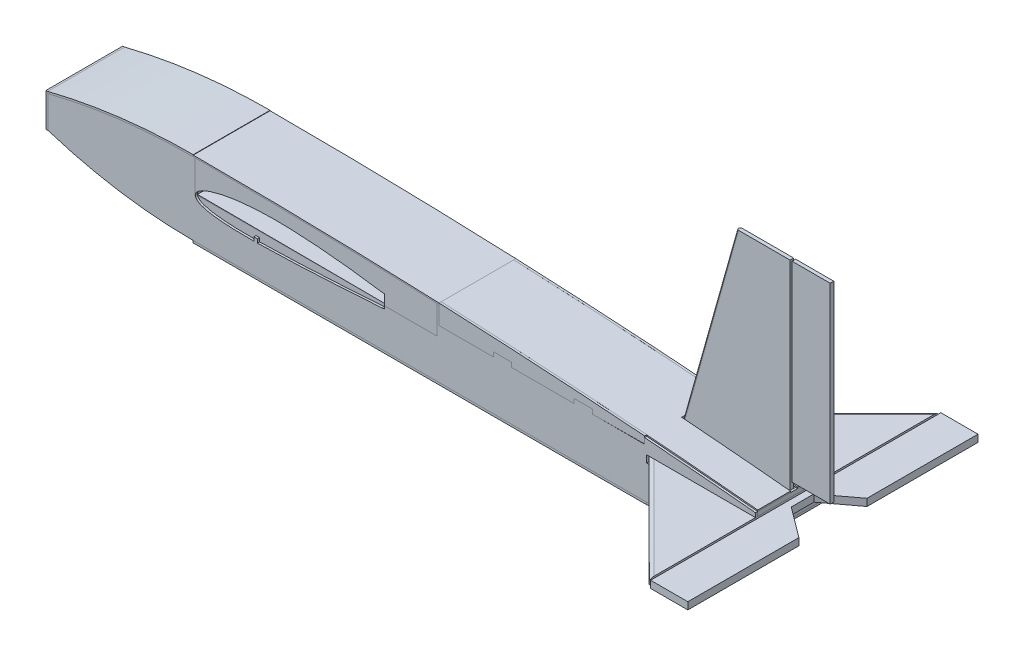
from build123d import *

# Parameters (mm, degrees)
BOSS_EXTRUDE4_DEPTH              = 3
BOSS_EXTRUDE5_DEPTH              = 3
SKETCH12_W                       = 101.6
SKETCH12_H                       = 98.6
BOSS_EXTRUDE6_DEPTH              = 2.8
SKETCH13_W                       = 101.6
SKETCH13_H                       = 94.334624953
BOSS_EXTRUDE7_DEPTH              = 2.8
SKETCH14_W                       = 101.6
SKETCH14_H                       = 76.899975786
BOSS_EXTRUDE8_DEPTH              = 2.8
SKETCH15_W                       = 101.6
SKETCH15_H                       = 31.75
BOSS_EXTRUDE9_DEPTH              = 2.8
SKETCH16_W                       = 101.6
SKETCH16_H                       = 66.907612553
BOSS_EXTRUDE10_DEPTH             = 8.399999964
BOSS_EXTRUDE10_DRAFT             = -7
CUT_EXTRUDE1_DEPTH               = 995.093803285
CUT_EXTRUDE1_DEPTH_BACK          = 995.093803285
SKETCH18_W                       = 152.4
SKETCH18_H                       = 10
SKETCH19_W                       = 149.6
SKETCH19_H                       = 11.952
BOSS_EXTRUDE12_DEPTH             = 10
BOSS_EXTRUDE12_2_DEPTH           = 10
BOSS_EXTRUDE13_DEPTH             = 10
SKETCH21_W                       = 139.7
SKETCH21_H                       = 12.7
BOSS_EXTRUDE14_DEPTH             = 10
BOSS_EXTRUDE14_2_DEPTH           = 10
CHAMFER1_SIZE                    = 76.2
CHAMFER1_SIZE2                   = 8.008942727
CHAMFER2_SIZE                    = 76.2
CHAMFER2_SIZE2                   = 8.008942727
CUT_EXTRUDE2_DEPTH               = 1014.488857078
CUT_EXTRUDE2_DEPTH_BACK          = 1014.488857078
SKETCH22_R                       = 1.27
SKETCH23_W                       = 406.4
SKETCH23_H                       = 10
BOSS_EXTRUDE15_DEPTH             = 52.07
CUT_EXTRUDE3_DEPTH               = 1067.340272357
CUT_EXTRUDE3_DEPTH_BACK          = 1067.340272357
SKETCH25_W                       = 127
SKETCH25_H                       = 5
BOSS_EXTRUDE16_REACH             = 1068.674
BOSS_EXTRUDE16_DIRECTION_2_REACH = 1068.674
BOSS_EXTRUDE17_REACH             = 1102.826
SKETCH27_W                       = 53.34
SKETCH27_H                       = 267.97
BOSS_EXTRUDE17_DIRECTION_2_REACH = 1102.826
CUT_EXTRUDE4_DEPTH               = 1101.826300603
CUT_EXTRUDE4_DEPTH_BACK          = 1101.826300603
BOSS_EXTRUDE19_DEPTH             = 3
CUT_EXTRUDE5_DEPTH               = 1103.33207779
EXTRUDE_THIN2_START              = -53.8
EXTRUDE_THIN2_DEPTH              = 107.6
EXTRUDE_THIN4_START              = -50.8
EXTRUDE_THIN4_DEPTH              = 101.6
CUT_EXTRUDE_THIN2_DEPTH          = 5
CUT_EXTRUDE_THIN2_DEPTH_BACK     = 5
CUT_EXTRUDE6_START               = -53.8
CUT_EXTRUDE6_DEPTH               = 107.6
BOSS_EXTRUDE21_DEPTH             = 3
EXTRUDE_THIN5_START              = -53.8
EXTRUDE_THIN5_DEPTH              = 107.6
CUT_EXTRUDE7_DEPTH               = 646.433676735
CUT_EXTRUDE7_DEPTH_BACK          = 646.433676735
SKETCH46_W                       = 101.6
SKETCH46_H                       = 3.058553549
SKETCH47_W                       = 107.6
SKETCH47_H                       = 3
BOSS_EXTRUDE22_DEPTH             = 155.672163536
SKETCH48_W                       = 101.6
SKETCH48_H                       = 3
SWEEP6_START                     = 203.2
SWEEP6_OUTLINE_W                 = 3
SWEEP6_OUTLINE_H                 = 107.6
SWEEP6_DEPTH                     = 635
SKETCH49_W                       = 107.6
SKETCH49_H                       = 47.213653824
BOSS_EXTRUDE23_DEPTH             = 3
FILLET1_R                        = 5.08
FILLET2_R                        = 2.54
EXTRUDE_THIN6_START              = -50.8
EXTRUDE_THIN6_DEPTH              = 101.6
SKETCH51_W                       = 338.57
SKETCH51_H                       = 51.722808022
BOSS_EXTRUDE24_DEPTH             = 10


# Read off the part's stored shape, not the designer's step: Extrude-Thin2, Extrude-Thin4, Cut-Extrude6, Extrude-Thin5, Sweep6, Extrude-Thin6
with BuildPart() as part:
    # Sketch7 → Boss-Extrude4 (new body)
    with BuildSketch(Plane.XY.offset(50.8)):
        with BuildLine():
            ThreePointArc((203.2, 38.1), (100.827823604, 31.801244765), (0, 13))
            Line((0, 13), (0, -31.75))
            ThreePointArc((0, -31.75), (100.367244397, -55.514635862), (203.2, -63.5))
            Line((203.2, -63.5), (838.2, -63.5))
            Line((838.2, -63.5), (990.6, -31.75))
            Line((990.6, -31.75), (990.6, 0))
            ThreePointArc((990.6, 0), (597.360617642, 28.56943127), (203.2, 38.1))
        make_face()
    extrude(amount=BOSS_EXTRUDE4_DEPTH)


with BuildPart() as body_2:
    # Sketch8 → Boss-Extrude5 (new body)
    with BuildSketch(Plane.XY.offset(-50.8)):
        with BuildLine():
            Line((990.6, -31.75), (990.6, 0))
            ThreePointArc((990.6, 0), (597.360617642, 28.56943127), (203.2, 38.1))
            ThreePointArc((203.2, 38.1), (100.827823604, 31.801244765), (0, 13))
            Line((0, 13), (0, -31.75))
            ThreePointArc((0, -31.75), (100.367244397, -55.514635862), (203.2, -63.5))
            Line((203.2, -63.5), (838.2, -63.5))
            Line((838.2, -63.5), (990.6, -31.75))
        make_face()
    extrude(amount=-BOSS_EXTRUDE5_DEPTH)


with BuildPart() as body_3:
    # Sketch12 → Boss-Extrude6 (new body)
    with BuildSketch(Plane(origin=(203.2, 0, 0), x_dir=(0, 0, -1), z_dir=(1, 0, 0))):
        with Locations((0, -11.2)):
            Rectangle(SKETCH12_W, SKETCH12_H)
    extrude(amount=BOSS_EXTRUDE6_DEPTH)


with BuildPart() as body_4:
    # Sketch13 → Boss-Extrude7 (new body)
    with BuildSketch(Plane(origin=(547.37, 0, 0), x_dir=(0, 0, -1), z_dir=(1, 0, 0))):
        with Locations((0, -16.332687524)):
            Rectangle(SKETCH13_W, SKETCH13_H)
    extrude(amount=-BOSS_EXTRUDE7_DEPTH)


with BuildPart() as body_5:
    # Sketch14 → Boss-Extrude8 (new body)
    with BuildSketch(Plane(origin=(838.2, 0, 0), x_dir=(0, 0, -1), z_dir=(1, 0, 0))):
        with Locations((0, -25.108565656)):
            Rectangle(SKETCH14_W, SKETCH14_H)
    extrude(amount=-BOSS_EXTRUDE8_DEPTH)


with BuildPart() as body_6:
    # Sketch15 → Boss-Extrude9 (new body)
    with BuildSketch(Plane(origin=(990.6, 0, 0), x_dir=(0, 0, -1), z_dir=(1, 0, 0))):
        with Locations((0, -15.875)):
            Rectangle(SKETCH15_W, SKETCH15_H)
    extrude(amount=-BOSS_EXTRUDE9_DEPTH)


with BuildPart() as body_7:
    # Sketch16 → Boss-Extrude10 (with draft: the straight prism first)
    with BuildSketch(Plane(origin=(50.8, 0, 0), x_dir=(0, 0, -1), z_dir=(1, 0, 0))):
        with Locations((0, -9.37813313)):
            Rectangle(SKETCH16_W, SKETCH16_H)
    extrude(amount=BOSS_EXTRUDE10_DEPTH)
    # Boss-Extrude10: the draft: its side faces are tilted about the plane it starts from
    boss_extrude10_sides = [body_7.faces().sort_by_distance(p)[0] for p in [
        (54.999999982, -9.37813313, 50.8),
        (54.999999982, -42.831939406, 0),
        (54.999999982, -9.37813313, -50.8),
        (54.999999982, 24.075673147, 0),
    ]]
    draft(boss_extrude10_sides, Plane(origin=(50.8, 0, 0), x_dir=(0, 0, -1), z_dir=(1, 0, 0)), BOSS_EXTRUDE10_DRAFT)


with BuildPart() as cut_extrude1_tool:
    # Sketch18 → Cut-Extrude1 (new, two sides: drawn at the far end of the back side and taken through both)
    with BuildSketch(Plane.XY.offset(-CUT_EXTRUDE1_DEPTH_BACK)):
        with Locations((914.4, -10.875)):
            Rectangle(SKETCH18_W, SKETCH18_H)
    extrude(amount=CUT_EXTRUDE1_DEPTH + CUT_EXTRUDE1_DEPTH_BACK)


with BuildPart() as part_1:
    add(part.part)

    # Cut-Extrude1: cut by cut_extrude1_tool
    add(cut_extrude1_tool.part, mode=Mode.SUBTRACT)


with BuildPart() as body_2_1:
    add(body_2.part)

    # Cut-Extrude1: cut by cut_extrude1_tool
    add(cut_extrude1_tool.part, mode=Mode.SUBTRACT)


with BuildPart() as body_6_1:
    add(body_6.part)

    # Cut-Extrude1: cut by cut_extrude1_tool
    add(cut_extrude1_tool.part, mode=Mode.SUBTRACT)


with BuildPart() as body_8:
    # Sketch19 → Boss-Extrude12 (new body)
    with BuildSketch(Plane(origin=(0, -15.875, 0), x_dir=(1, 0, 0), z_dir=(0, 1, 0))):
        with Locations((913, -44.824)):
            Rectangle(SKETCH19_W, SKETCH19_H)
    extrude(amount=-BOSS_EXTRUDE12_DEPTH)


with BuildPart() as body_9:
    # Sketch19 → Boss-Extrude12 2 (new body)
    with BuildSketch(Plane(origin=(0, -15.875, 0), x_dir=(1, 0, 0), z_dir=(0, 1, 0))):
        with Locations((913, 44.824)):
            Rectangle(SKETCH19_W, SKETCH19_H)
    extrude(amount=-BOSS_EXTRUDE12_2_DEPTH)


with BuildPart() as body_10:
    # Sketch20 → Boss-Extrude13 (new body)
    with BuildSketch(Plane(origin=(0, -15.875, 0), x_dir=(1, 0, 0), z_dir=(0, 1, 0))):
        Polygon((838.2, 50.8), (838.2, -50.8), (990.6, -203.2), (990.6, 203.2), align=None)
    extrude(amount=BOSS_EXTRUDE13_DEPTH)


with BuildPart() as body_11:
    # Sketch21 → Boss-Extrude14 (new body)
    with BuildSketch(Plane(origin=(0, -5.875, 0), x_dir=(1, 0, 0), z_dir=(0, 1, 0))):
        with Locations((908.05, 44.45)):
            Rectangle(SKETCH21_W, SKETCH21_H)
    extrude(amount=BOSS_EXTRUDE14_DEPTH)

    # Chamfer1
    chamfer1_edges = [body_11.edges().sort_by_distance(p)[0] for p in [
        (977.9, 4.125, -44.45),
    ]]
    chamfer1_side = [body_11.faces().sort_by_distance(p)[0] for p in [
        (908.05, 4.125, -44.45),
    ]]
    chamfer(chamfer1_edges, length=CHAMFER1_SIZE, length2=CHAMFER1_SIZE2, reference=chamfer1_side[0])


with BuildPart() as body_12:
    # Sketch21 → Boss-Extrude14 2 (new body)
    with BuildSketch(Plane(origin=(0, -5.875, 0), x_dir=(1, 0, 0), z_dir=(0, 1, 0))):
        with Locations((908.05, -44.45)):
            Rectangle(SKETCH21_W, SKETCH21_H)
    extrude(amount=BOSS_EXTRUDE14_2_DEPTH)

    # Chamfer2
    chamfer2_edges = [body_12.edges().sort_by_distance(p)[0] for p in [
        (977.9, 4.125, 44.45),
    ]]
    chamfer2_side = [body_12.faces().sort_by_distance(p)[0] for p in [
        (908.05, 4.125, 44.45),
    ]]
    chamfer(chamfer2_edges, length=CHAMFER2_SIZE, length2=CHAMFER2_SIZE2, reference=chamfer2_side[0])


with BuildPart() as cut_extrude2_tool:
    # Sketch22 → Cut-Extrude2 (new, two sides: drawn at the far end of the back side and taken through both)
    with BuildSketch(Plane(origin=(0, 4.125, 0), x_dir=(1, 0, 0), z_dir=(0, 1, 0)).offset(-CUT_EXTRUDE2_DEPTH_BACK)):
        with Locations(Location((872.077439947, 45.6, 0), (0, 0, 270))):
            Circle(SKETCH22_R)
        with Locations(Location((935.482, 45.6, 0), (0, 0, 270))):
            Circle(SKETCH22_R)
        with Locations(Location((935.482, -45.6, 0), (0, 0, 180))):
            Circle(SKETCH22_R)
        with Locations(Location((872.077439947, -45.6, 0), (0, 0, 90))):
            Circle(SKETCH22_R)
    extrude(amount=CUT_EXTRUDE2_DEPTH + CUT_EXTRUDE2_DEPTH_BACK)


with BuildPart() as body_8_1:
    add(body_8.part)

    # Cut-Extrude2: cut by cut_extrude2_tool
    add(cut_extrude2_tool.part, mode=Mode.SUBTRACT)


with BuildPart() as body_9_1:
    add(body_9.part)

    # Cut-Extrude2: cut by cut_extrude2_tool
    add(cut_extrude2_tool.part, mode=Mode.SUBTRACT)


with BuildPart() as body_10_1:
    add(body_10.part)

    # Cut-Extrude2: cut by cut_extrude2_tool
    add(cut_extrude2_tool.part, mode=Mode.SUBTRACT)

    # Sketch25 → Cut-Extrude3 (cut, two sides: drawn at the far end of the back side and taken through both)
    with BuildSketch(Plane(origin=(0, -5.875, 0), x_dir=(1, 0, 0), z_dir=(0, 1, 0)).offset(-CUT_EXTRUDE3_DEPTH_BACK)):
        with Locations((901.7, 0)):
            Rectangle(SKETCH25_W, SKETCH25_H)
    extrude(amount=CUT_EXTRUDE3_DEPTH + CUT_EXTRUDE3_DEPTH_BACK, mode=Mode.SUBTRACT)


with BuildPart() as body_11_1:
    add(body_11.part)

    # Cut-Extrude2: cut by cut_extrude2_tool
    add(cut_extrude2_tool.part, mode=Mode.SUBTRACT)


with BuildPart() as body_12_1:
    add(body_12.part)

    # Cut-Extrude2: cut by cut_extrude2_tool
    add(cut_extrude2_tool.part, mode=Mode.SUBTRACT)


with BuildPart() as body_13:
    # Sketch23 → Boss-Extrude15 (new body)
    with BuildSketch(Plane(origin=(993.14, 0, 0), x_dir=(0, 0, -1), z_dir=(1, 0, 0))):
        with Locations((0, -10.875)):
            Rectangle(SKETCH23_W, SKETCH23_H)
    extrude(amount=BOSS_EXTRUDE15_DEPTH)

    # Sketch33 → Cut-Extrude5 (cut, through all)
    with BuildSketch(Plane(origin=(0, -5.875, 0), x_dir=(1, 0, 0), z_dir=(0, 1, 0))):
        Polygon((1045.21, 47.658624954), (1002.753513304, 15.875), (1002.753513304, -15.875), (1045.21, -47.658624954), align=None)
    extrude(amount=-CUT_EXTRUDE5_DEPTH, mode=Mode.SUBTRACT)


with BuildPart() as body_14:

    # Boss-Extrude16: up to this face of the body (flat: up to its plane)
    boss_extrude16_end = Plane(body_10_1.part.faces().sort_by_distance((901.7, -10.875, -2.5))[0])
    # Sketch26 → Boss-Extrude16 (new, up to the picked face)
    with BuildSketch(Plane.XY, mode=Mode.PRIVATE) as boss_extrude16_sk1:
        Polygon((838.2, 13.341422237), (838.2, -63.558553549), (987.8, -32.333333333), (987.8, 279.4), (912.999999994, 279.4), align=None)
    boss_extrude16_tool1 = split(extrude(boss_extrude16_sk1.sketch, amount=-BOSS_EXTRUDE16_REACH, mode=Mode.PRIVATE), bisect_by=boss_extrude16_end, keep=Keep.BOTH, mode=Mode.PRIVATE)
    add(boss_extrude16_tool1.solids().sort_by(Axis((924.224072, 96.44888, 0), (0, 0, -1)))[0])


    # Boss-Extrude16 direction 2: up to this face of the body (flat: up to its plane)
    boss_extrude16_direction_2_end = Plane(body_10_1.part.faces().sort_by_distance((901.7, -10.875, 2.5))[0])
    # Sketch26 → Boss-Extrude16 direction 2 (add, up to the picked face)
    with BuildSketch(Plane.XY, mode=Mode.PRIVATE) as boss_extrude16_direction_2_sk1:
        Polygon((838.2, 13.341422237), (838.2, -63.558553549), (987.8, -32.333333333), (987.8, 279.4), (912.999999994, 279.4), align=None)
    boss_extrude16_direction_2_tool1 = split(extrude(boss_extrude16_direction_2_sk1.sketch, amount=BOSS_EXTRUDE16_DIRECTION_2_REACH, mode=Mode.PRIVATE), bisect_by=boss_extrude16_direction_2_end, keep=Keep.BOTH, mode=Mode.PRIVATE)
    add(boss_extrude16_direction_2_tool1.solids().sort_by(Axis((924.224072, 96.44888, 0), (0, 0, 1)))[0])


with BuildPart() as body_15:

    # Boss-Extrude17: up to this face of the body (flat: up to its plane)
    boss_extrude17_end = Plane(body_14.part.faces().sort_by_distance((924.224071658, 96.448879646, 2.5))[0])
    # Sketch27 → Boss-Extrude17 (new, up to the picked face)
    with BuildSketch(Plane.XY, mode=Mode.PRIVATE) as boss_extrude17_sk1:
        with Locations((1017.27, 145.415)):
            Rectangle(SKETCH27_W, SKETCH27_H)
    boss_extrude17_tool1 = split(extrude(boss_extrude17_sk1.sketch, amount=BOSS_EXTRUDE17_REACH, mode=Mode.PRIVATE), bisect_by=boss_extrude17_end, keep=Keep.BOTH, mode=Mode.PRIVATE)
    add(boss_extrude17_tool1.solids().sort_by(Axis((1017.27, 145.415, 0), (0, 0, 1)))[0])


    # Boss-Extrude17 direction 2: up to this face of the body (flat: up to its plane)
    boss_extrude17_direction_2_end = Plane(body_14.part.faces().sort_by_distance((924.224071658, 96.448879646, -2.5))[0])
    # Sketch27 → Boss-Extrude17 direction 2 (add, up to the picked face)
    with BuildSketch(Plane.XY, mode=Mode.PRIVATE) as boss_extrude17_direction_2_sk1:
        with Locations((1017.27, 145.415)):
            Rectangle(SKETCH27_W, SKETCH27_H)
    boss_extrude17_direction_2_tool1 = split(extrude(boss_extrude17_direction_2_sk1.sketch, amount=-BOSS_EXTRUDE17_DIRECTION_2_REACH, mode=Mode.PRIVATE), bisect_by=boss_extrude17_direction_2_end, keep=Keep.BOTH, mode=Mode.PRIVATE)
    add(boss_extrude17_direction_2_tool1.solids().sort_by(Axis((1017.27, 145.415, 0), (0, 0, -1)))[0])


with BuildPart() as cut_extrude4_tool:
    # Sketch30 → Cut-Extrude4 (new, two sides: drawn at the far end of the back side and taken through both)
    with BuildSketch(Plane.XY.offset(-CUT_EXTRUDE4_DEPTH_BACK)):
        with BuildLine():
            Line((547.37, 30.834624953), (547.37, 26.064915322))
            Line((547.37, 26.064915322), (547.37, 13.364915322))
            Line((547.37, 13.364915322), (547.37, 5.434624953))
            Line((547.37, 5.434624953), (623.57, 5.434624953))
            Line((623.57, 5.434624953), (623.57, 11.784624953))
            Line((623.57, 11.784624953), (648.97, 11.784624953))
            Line((648.97, 11.784624953), (648.97, 5.434624953))
            Line((648.97, 5.434624953), (736.6, 5.434624953))
            Line((736.6, 5.434624953), (736.6, 11.664822713))
            Line((736.6, 11.664822713), (762, 11.664822713))
            Line((762, 11.664822713), (762, 5.434624953))
            Line((762, 5.434624953), (835.4, 5.434624953))
            Line((835.4, 5.434624953), (835.4, 13.559612986))
            ThreePointArc((835.4, 13.559612986), (691.461406149, 23.47105517), (547.37, 30.834624953))
        make_face()
    extrude(amount=CUT_EXTRUDE4_DEPTH + CUT_EXTRUDE4_DEPTH_BACK)


with BuildPart() as part_2:
    add(part_1.part)

    # Cut-Extrude4: cut by cut_extrude4_tool
    add(cut_extrude4_tool.part, mode=Mode.SUBTRACT)


with BuildPart() as body_2_2:
    add(body_2_1.part)

    # Cut-Extrude4: cut by cut_extrude4_tool
    add(cut_extrude4_tool.part, mode=Mode.SUBTRACT)


with BuildPart() as body_16:
    # Sketch32 → Boss-Extrude19 (new body)
    with BuildSketch(Plane.XY.offset(50.8)):
        with BuildLine():
            Line((835.4, 5.744915322), (835.4, 15.56564777))
            ThreePointArc((835.4, 15.56564777), (691.461368545, 25.474650484), (547.37, 32.836407812))
            Line((547.37, 32.836407812), (547.37, 5.434624953))
            Line((547.37, 5.434624953), (623.57, 5.434624953))
            Line((623.57, 5.434624953), (623.57, 11.784624953))
            Line((623.57, 11.784624953), (648.97, 11.784624953))
            Line((648.97, 11.784624953), (648.97, 5.434624953))
            Line((648.97, 5.434624953), (736.6, 5.434624953))
            Line((736.6, 5.434624953), (736.6, 11.664822713))
            Line((736.6, 11.664822713), (762, 11.664822713))
            Line((762, 11.664822713), (762, 5.434624953))
            Line((762, 5.434624953), (835.4, 5.744915322))
        make_face()
    extrude(amount=BOSS_EXTRUDE19_DEPTH)


with BuildPart() as body_17:
    # Extrude-Thin2 outline → Extrude-Thin2 (new body)
    with BuildSketch(Plane.XY.offset(EXTRUDE_THIN2_START)):
        with BuildLine():
            Line((203.2, 40.1), (203.2, 38.1))
            ThreePointArc((203.2, 38.1), (375.323338463, 36.283453931), (547.37, 30.834624953))
            Line((547.37, 30.834624953), (547.454401765, 32.832843245))
            ThreePointArc((547.454401765, 32.832843245), (375.365548747, 38.283008454), (203.2, 40.1))
        make_face()
    extrude(amount=EXTRUDE_THIN2_DEPTH)


with BuildPart() as body_18:
    # Extrude-Thin4 outline → Extrude-Thin4 (new body)
    with BuildSketch(Plane.XY.offset(EXTRUDE_THIN4_START)):
        with BuildLine():
            ThreePointArc((547.37, 30.834624953), (769.195017424, 18.436192163), (990.6, 0))
            Line((990.6, 0), (990.793096289, 1.990656631))
            ThreePointArc((990.793096289, 1.990656631), (769.333817954, 20.431369953), (547.454401765, 32.832843245))
            Line((547.454401765, 32.832843245), (547.37, 30.834624953))
        make_face()
    extrude(amount=EXTRUDE_THIN4_DEPTH)

    # Sketch39 → Cut-Extrude-Thin2 (cut, two sides: drawn at the far end of the back side and taken through both)
    with BuildSketch(Plane.XY.offset(-CUT_EXTRUDE_THIN2_DEPTH_BACK)):
        with BuildLine():
            ThreePointArc((990.6, 0), (914.43128333, 7.028062784), (838.2, 13.341422237))
            Line((838.2, 13.341422237), (838.355722813, 15.335350623))
            ThreePointArc((838.355722813, 15.335350623), (914.605700552, 9.020442926), (990.793096289, 1.990656631))
            Line((990.793096289, 1.990656631), (990.6, 0))
        make_face()
    extrude(amount=CUT_EXTRUDE_THIN2_DEPTH + CUT_EXTRUDE_THIN2_DEPTH_BACK, mode=Mode.SUBTRACT)


with BuildPart() as cut_extrude6_tool:
    # Cut-Extrude6 outline → Cut-Extrude6 (new body)
    with BuildSketch(Plane.XY.offset(CUT_EXTRUDE6_START)):
        with BuildLine():
            Line((206, 38.099519344), (206, -7.62))
            add(Edge.make_bspline(
                [(206, -7.62), (206.226545056, -9.759348592), (209.484172125, -13.160140385), (213.460827525, -14.90791796), (215.45485252, -15.629098382), (215.999999998, -15.816240432)],
                knots=[0.503458853, 0.503458853, 0.503458853, 0.503458853, 0.513609129, 0.520450991, 0.522992759, 0.522992759, 0.522992759, 0.522992759], degree=3))
            add(Edge.make_bspline(
                [(215.999999998, -15.816240432), (218.196794439, -16.570371434), (223.245696392, -17.946271057), (231.100617306, -19.299173831), (242.294284523, -20.537477836), (256.266698732, -21.490584395), (272.489945349, -21.860094186), (283.112637443, -21.84001945), (288.14550001, -21.786095302)],
                knots=[0.522992759, 0.522992759, 0.522992759, 0.522992759, 0.533235388, 0.545691039, 0.558031884, 0.582609167, 0.607134742, 0.629220983, 0.629220983, 0.629220983, 0.629220983], degree=3))
            Line((288.14550001, -21.786095302), (288.1455, -16.544172161))
            Line((288.1455, -16.544172161), (293.1455, -16.544172161))
            Line((293.1455, -16.544172161), (293.1455, -21.718551))
            add(Edge.make_bspline(
                [(293.1455, -21.718551), (297.620369049, -21.646328126), (313.27225525, -21.290764851), (340.100983831, -20.438337908), (373.626044522, -18.893353914), (407.141383972, -16.885258558), (438.408988763, -14.938317905), (458.504477382, -13.67348194), (467.424971136, -13.092573591)],
                knots=[0.636535264, 0.636535264, 0.636535264, 0.636535264, 0.656174272, 0.705233949, 0.754320379, 0.803437364, 0.852566096, 0.891793471, 0.891793471, 0.891793471, 0.891793471], degree=3))
            Line((467.424971136, -13.092573591), (468.193581633, -13.042472662))
            Line((468.193581633, -13.042472662), (471.09971774, -12.746877148))
            Line((471.09971774, -12.746877148), (471.099717738, -8.777191978))
            Line((471.099717738, -8.777191978), (544.57, -8.777191978))
            Line((544.57, -8.777191978), (544.57, 30.952410847))
            ThreePointArc((544.57, 30.952410847), (375.3221006, 36.283480062), (206, 38.099519344))
        make_face()
    extrude(amount=CUT_EXTRUDE6_DEPTH)


with BuildPart() as part_3:
    add(part_2.part)

    # Cut-Extrude6: cut by cut_extrude6_tool
    add(cut_extrude6_tool.part, mode=Mode.SUBTRACT)


with BuildPart() as body_2_3:
    add(body_2_2.part)

    # Cut-Extrude6: cut by cut_extrude6_tool
    add(cut_extrude6_tool.part, mode=Mode.SUBTRACT)


with BuildPart() as body_19:
    # Sketch43 → Boss-Extrude21 (new body)
    with BuildSketch(Plane.XY.offset(50.8)):
        with BuildLine():
            Line((288.1455, 17.987374349), (293.1455, 18.282930222))
            add(Edge.make_bspline(
                [(468.193581623, 5.864915216), (459.028376369, 7.244206321), (438.708339943, 10.110142164), (407.190345957, 13.874080318), (373.652012091, 16.805484843), (340.121316052, 18.790622057), (313.260761198, 19.113252423), (297.617066258, 18.521220762), (293.1455, 18.282930222)],
                knots=[0.108536018, 0.108536018, 0.108536018, 0.108536018, 0.14920632, 0.198581097, 0.24780517, 0.296916575, 0.345952722, 0.3656013, 0.3656013, 0.3656013, 0.3656013], degree=3))
            Line((468.193581623, 5.864915216), (471.09971773, 5.864915218))
            Line((471.09971773, 5.864915218), (471.099717738, -8.777191978))
            Line((471.099717738, -8.777191978), (544.57, -8.777191978))
            Line((544.57, -8.777191978), (544.57, 30.952410847))
            ThreePointArc((544.57, 30.952410847), (375.3221006, 36.283480062), (206, 38.1))
            Line((206, 38.1), (206, -6.73696996))
            add(Edge.make_bspline(
                [(215.999999998, 3.261857509), (215.452402223, 2.983456272), (213.44206922, 1.918935131), (209.535157345, -0.511504974), (206.231822612, -4.439240166), (206, -6.73696996)],
                knots=[0.481165424, 0.481165424, 0.481165424, 0.481165424, 0.483879409, 0.49126412, 0.502069641, 0.502069641, 0.502069641, 0.502069641], degree=3))
            add(Edge.make_bspline(
                [(288.1455, 17.987374349), (283.104872995, 17.659718215), (272.453791451, 16.774335071), (256.200804275, 14.696949969), (242.215891962, 12.052120912), (231.066845415, 9.059883486), (223.201284543, 6.528415399), (218.170835622, 4.365520358), (215.999999998, 3.261857509)],
                knots=[0.372927197, 0.372927197, 0.372927197, 0.372927197, 0.395091204, 0.419814796, 0.444798575, 0.457489819, 0.470406405, 0.481165424, 0.481165424, 0.481165424, 0.481165424], degree=3))
        make_face()
    extrude(amount=BOSS_EXTRUDE21_DEPTH)


with BuildPart() as body_20:
    # Extrude-Thin5 outline → Extrude-Thin5 (new body)
    with BuildSketch(Plane.XY.offset(EXTRUDE_THIN5_START)):
        with BuildLine():
            ThreePointArc((0, 13), (100.827823604, 31.801244765), (203.2, 38.1))
            Line((203.2, 38.1), (203.2, 40.64))
            ThreePointArc((203.2, 40.64), (100.516440168, 34.322085966), (-0.618069444, 15.463653824))
            Line((-0.618069444, 15.463653824), (0, 13))
        make_face()
    extrude(amount=EXTRUDE_THIN5_DEPTH)


with BuildPart() as cut_extrude7_tool:
    # Sketch46 → Cut-Extrude7 (new, two sides: drawn at the far end of the back side and taken through both)
    with BuildSketch(Plane.ZY.offset(-544.57).offset(-CUT_EXTRUDE7_DEPTH_BACK)):
        with Locations((0, -62.029276775)):
            Rectangle(SKETCH46_W, SKETCH46_H)
    extrude(amount=CUT_EXTRUDE7_DEPTH + CUT_EXTRUDE7_DEPTH_BACK)


with BuildPart() as body_4_1:
    add(body_4.part)

    # Cut-Extrude7: cut by cut_extrude7_tool
    add(cut_extrude7_tool.part, mode=Mode.SUBTRACT)


with BuildPart() as body_5_1:
    add(body_5.part)

    # Cut-Extrude7: cut by cut_extrude7_tool
    add(cut_extrude7_tool.part, mode=Mode.SUBTRACT)


with BuildPart() as body_14_1:
    add(body_14.part)

    # Cut-Extrude7: cut by cut_extrude7_tool
    add(cut_extrude7_tool.part, mode=Mode.SUBTRACT)

    # Fillet2
    # the kernel refuses this fillet: 2.54 mm, written as the material it takes off along each edge
    with BuildSketch(Plane(origin=(834.075318071, -1.329794446, -2.5), x_dir=(0.9626782600882348, -0.2706484205634479, 0), z_dir=(0.27064842056344796, 0.9626782600882349, 0)), Plane(origin=(834.075318071, -1.329794446, 2.5), x_dir=(0, 0, -1), z_dir=(0.27064842056344796, 0.9626782600882349, 0))) as fillet2_piece_1:
        with BuildLine():
            CenterArc((FILLET2_R, -FILLET2_R), FILLET2_R, 90, 90)
            Line((0, -FILLET2_R), (-FILLET2_R * 0.02, -FILLET2_R))
            Line((-FILLET2_R * 0.02, -FILLET2_R), (-FILLET2_R * 0.02, FILLET2_R * 0.02))
            Line((-FILLET2_R * 0.02, FILLET2_R * 0.02), (FILLET2_R, FILLET2_R * 0.02))
            Line((FILLET2_R, FILLET2_R * 0.02), (FILLET2_R, 0))
        make_face()
    extrude(amount=306.853310579, mode=Mode.SUBTRACT)


with BuildPart() as body_21:
    # Sketch47 → Boss-Extrude22 (new, along a direction that is not the sketch's normal)
    with BuildSketch(Plane(origin=(990.6, 0, 0), x_dir=(0, 0, -1), z_dir=(1, 0, 0))):
        with Locations((0, -33.25)):
            Rectangle(SKETCH47_W, SKETCH47_H)
    extrude(amount=-BOSS_EXTRUDE22_DEPTH, dir=(0.9789804197376051, 0.2039542541120011, 0))


with BuildPart() as body_22:
    # Sweep1: sweep along a curve in space
    with BuildLine() as sweep1_path:
        ThreePointArc((0, -31.75, 50.8), (100.367244397, -55.514635862, 50.8), (203.2, -63.5, 50.8))
    # Sketch48 → Sweep1 (sweep)
    with BuildSketch(Plane.ZY.offset(-203.2)):
        with Locations((0, -62)):
            Rectangle(SKETCH48_W, SKETCH48_H)
    sweep(path=sweep1_path.line)


with BuildPart() as body_23:
    # Sweep6 outline → Sweep6 (new body)
    with BuildSketch(Plane.YZ.offset(SWEEP6_START)):
        with Locations((-65, 0)):
            Rectangle(SWEEP6_OUTLINE_W, SWEEP6_OUTLINE_H)
    extrude(amount=SWEEP6_DEPTH)


with BuildPart() as body_24:
    # Sketch49 → Boss-Extrude23 (new body)
    with BuildSketch(Plane.ZY):
        with Locations((0, -8.143173088)):
            Rectangle(SKETCH49_W, SKETCH49_H)
    extrude(amount=BOSS_EXTRUDE23_DEPTH)


with BuildPart() as body_25:
    # Mirror1: mirrored copy
    add(body_19.part.mirror(Plane.XY))


with BuildPart() as body_26:
    # Mirror1 2: mirrored copy
    add(body_16.part.mirror(Plane.XY))


with BuildPart() as body_10_2:
    add(body_10_1.part)

    # Fillet1
    # the kernel refuses this fillet: 5.08 mm, written as the material it takes off along each edge
    with BuildSketch(Plane(origin=(999.580256121, -15.875, -212.180256121), x_dir=(0.7071067811865472, 0, 0.7071067811865478), z_dir=(-0.7071067811865478, 0, 0.7071067811865474)), Plane(origin=(829.219743879, -15.875, 41.819743879), x_dir=(0.7071067811865474, 0, -0.7071067811865477), z_dir=(0.7071067811865477, 0, 0.7071067811865474))) as fillet1_piece_1:
        with BuildLine():
            CenterArc((FILLET1_R, FILLET1_R), FILLET1_R, 180, 90)
            Line((0, FILLET1_R), (0, 0))
            Line((0, 0), (FILLET1_R, 0))
        make_face()
    extrude(amount=240.926146906, mode=Mode.SUBTRACT)
    with BuildSketch(Plane(origin=(999.580256121, -5.875, -212.180256121), x_dir=(0.7071067811865472, 0, 0.7071067811865478), z_dir=(-0.7071067811865478, 0, 0.7071067811865474)), Plane(origin=(829.219743879, -5.875, 41.819743879), x_dir=(0.7071067811865474, 0, -0.7071067811865477), z_dir=(0.7071067811865477, 0, 0.7071067811865474))) as fillet1_piece_2:
        with BuildLine():
            CenterArc((FILLET1_R, -FILLET1_R), FILLET1_R, 90, 90)
            Line((0, -FILLET1_R), (0, 0))
            Line((0, 0), (FILLET1_R, 0))
        make_face()
    extrude(amount=240.926146906, mode=Mode.SUBTRACT)


with BuildPart() as body_27:
    # Extrude-Thin6 outline → Extrude-Thin6 (new body)
    with BuildSketch(Plane.XY.offset(EXTRUDE_THIN6_START)):
        Polygon((206, -7.62), (205.97817461, -12.619952365), (471.088804991, -13.777191978), (544.57, -13.777191978), (544.57, -8.777191978), (471.099717738, -8.777191978), align=None)
    extrude(amount=EXTRUDE_THIN6_DEPTH)


with BuildPart() as body_28:
    # Sketch51 → Boss-Extrude24 (new body)
    with BuildSketch(Plane.XY.offset(-50.8)):
        with Locations((375.285, -34.638595989)):
            Rectangle(SKETCH51_W, SKETCH51_H)
    extrude(amount=BOSS_EXTRUDE24_DEPTH)


with BuildPart() as body_29:
    # Mirror2: mirrored copy
    add(body_28.part.mirror(Plane.XY))


solid = Compound([body_3.part, body_7.part, body_6_1.part, body_8_1.part, body_9_1.part, body_11_1.part, body_12_1.part, body_13.part, body_15.part, body_16.part, body_17.part, body_18.part, part_3.part, body_2_3.part, body_19.part, body_20.part, body_4_1.part, body_5_1.part, body_14_1.part, body_21.part, body_22.part, body_23.part, body_24.part, body_25.part, body_26.part, body_10_2.part, body_27.part, body_28.part, body_29.part])
